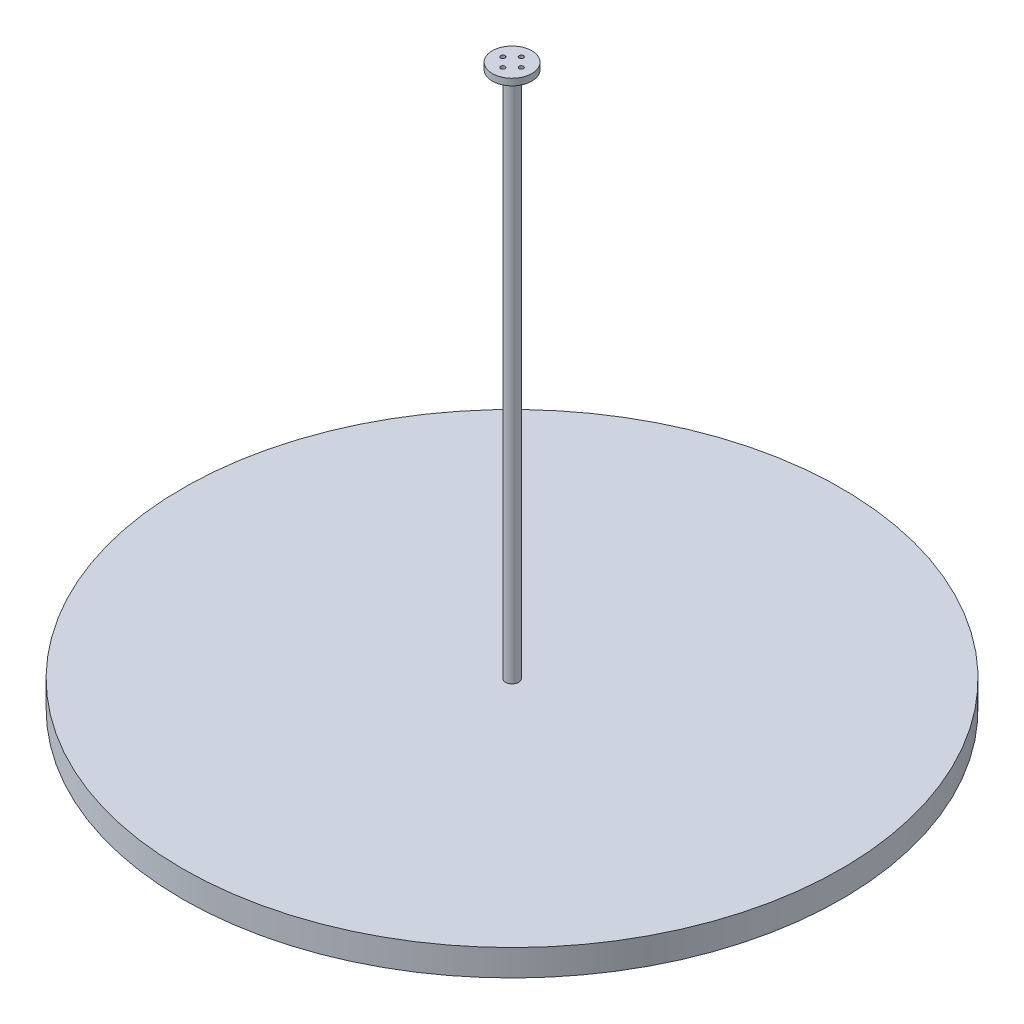
from build123d import *

# Parameters (mm, degrees)
SKETCH_1_R               = 250
EXTRUDE_1_DEPTH          = 20
SKETCH_2_R               = 5
EXTRUDE_2_DEPTH          = 400
SKETCH_3_R               = 15
EXTRUDE_3_DEPTH          = 5
SKETCH_4_R               = 1.65
CUT_EXTRUDE_1_DEPTH      = 5
PATTERN_CIRCULAR_1_COUNT = 4


with BuildPart() as part:
    # 草图1 → 凸台-拉伸1 (new body)
    with BuildSketch(Plane(origin=(0, 0, 0), x_dir=(1, 0, 0), z_dir=(0, 1, 0))):
        Circle(SKETCH_1_R)
    extrude(amount=EXTRUDE_1_DEPTH)

    # 草图2 → 凸台-拉伸2 (add)
    with BuildSketch(Plane(origin=(0, 20, 0), x_dir=(1, 0, 0), z_dir=(0, 1, 0))):
        Circle(SKETCH_2_R)
    extrude(amount=EXTRUDE_2_DEPTH)

    # 草图3 → 凸台-拉伸3 (add)
    with BuildSketch(Plane(origin=(0, 420, 0), x_dir=(1, 0, 0), z_dir=(0, 1, 0))):
        Circle(SKETCH_3_R)
    extrude(amount=EXTRUDE_3_DEPTH)

    # 草图4 → 切除-拉伸1 (cut)
    with BuildSketch(Plane(origin=(0, 425, 0), x_dir=(1, 0, 0), z_dir=(0, 1, 0))):
        with Locations((-7, 0)):
            Circle(SKETCH_4_R)
    cut_extrude_1 = extrude(amount=-CUT_EXTRUDE_1_DEPTH, mode=Mode.SUBTRACT)

    # 阵列(圆周)1: 切除-拉伸1 ×4 about axis
    pattern_circular_1_axis = Axis((0, 425, 0), (0, -1, 0))
    for i in range(1, PATTERN_CIRCULAR_1_COUNT):
        add(cut_extrude_1.rotate(pattern_circular_1_axis, i * 360 / PATTERN_CIRCULAR_1_COUNT), mode=Mode.SUBTRACT)


solid = part.part
